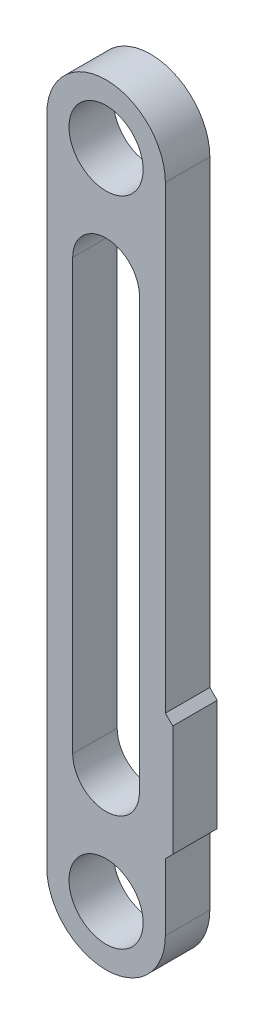
from build123d import *

# Parameters (mm, degrees)
SKETCH_1_R          = 5
EXTRUDE_1_DEPTH     = 6
CUT_EXTRUDE_1_DEPTH = 10
SKETCH_3_W          = 1
SKETCH_3_H          = 15
EXTRUDE_2_DEPTH     = 6
CHAMFER_1_SIZE      = 1


with BuildPart() as part:
    # 草图1 → 凸台-拉伸1 (new body)
    with BuildSketch(Plane.XY):
        with BuildLine():
            Line((-8, 0), (-8, 88))
            ThreePointArc((-8, 88), (0, 96), (8, 88))
            Line((8, 88), (8, 0))
            ThreePointArc((8, 0), (0, -8), (-8, 0))
        make_face()
        with Locations((0, 88)):
            Circle(SKETCH_1_R, mode=Mode.SUBTRACT)
        Circle(SKETCH_1_R, mode=Mode.SUBTRACT)
    extrude(amount=EXTRUDE_1_DEPTH)

    # 草图2 → 切除-拉伸1 (cut)
    with BuildSketch(Plane(origin=(0, 0, 0), x_dir=(-1, 0, 0), z_dir=(0, 0, -1))):
        with BuildLine():
            Line((4.5, 73), (4.5, 15))
            ThreePointArc((4.5, 15), (0, 10.5), (-4.5, 15))
            Line((-4.5, 15), (-4.5, 73))
            ThreePointArc((-4.5, 73), (0, 77.5), (4.5, 73))
        make_face()
    extrude(amount=-CUT_EXTRUDE_1_DEPTH, mode=Mode.SUBTRACT)

    # 草图3 → 凸台-拉伸2 (add)
    with BuildSketch(Plane.XY.offset(6)):
        with Locations((8.5, 17.5)):
            Rectangle(SKETCH_3_W, SKETCH_3_H)
    extrude(amount=-EXTRUDE_2_DEPTH)

    # 倒角1
    chamfer_1_edges = [part.edges().sort_by_distance(p)[0] for p in [
        (8, 10, 3),
        (8, 25, 3),
    ]]
    chamfer(chamfer_1_edges, length=CHAMFER_1_SIZE - 0.0001)  # a hair under: the kernel refuses the full size


solid = part.part
